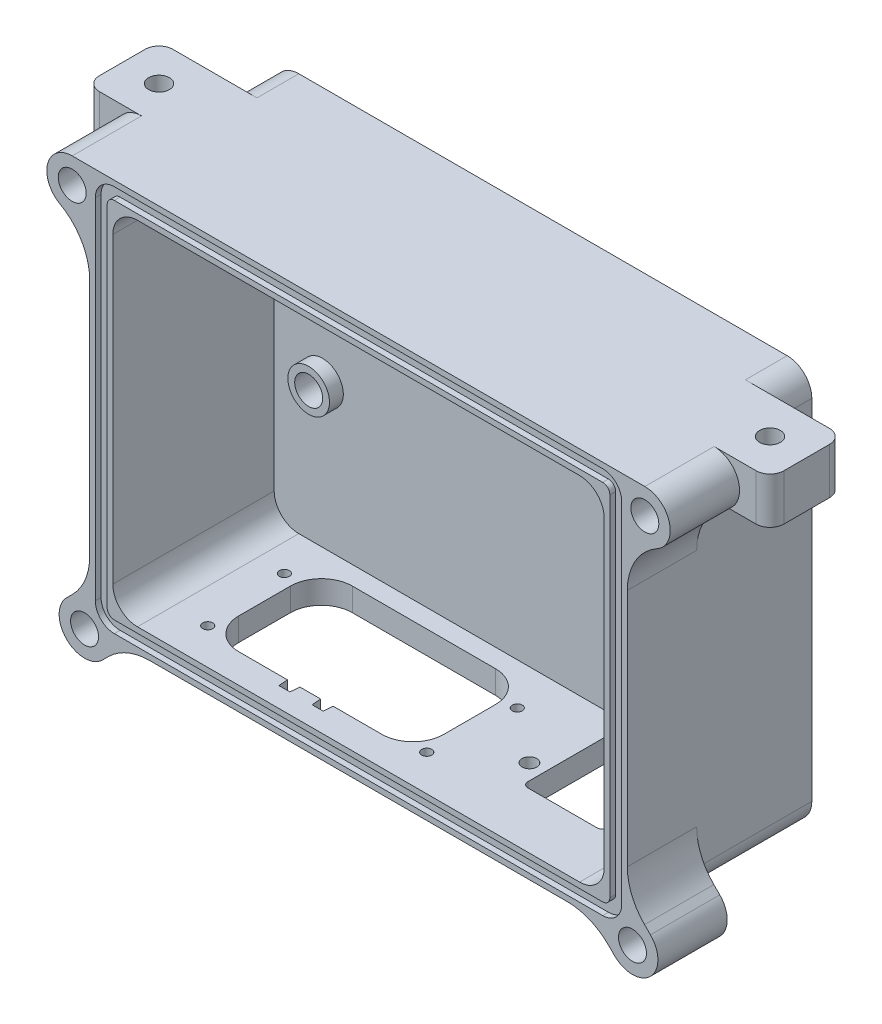
from build123d import *

# Parameters (mm, degrees)
SKETCH1_W             = 106.3625
SKETCH1_H             = 76.2
BOSS_EXTRUDE1_DEPTH   = 34.925
SHELL1_T              = 5
FILLET1_R             = 5.334
CUT_EXTRUDE1_DEPTH    = 1.2446
BOSS_EXTRUDE2_DEPTH   = 15
BOSS_EXTRUDE2_2_DEPTH = 15
SKETCH5_R             = 3.025
CUT_EXTRUDE4_DEPTH    = 8
FILLET2_R             = 12.7
SKETCH6_R             = 4.5
SKETCH6_R_2           = 3.025
BOSS_EXTRUDE3_DEPTH   = 3
CUT_EXTRUDE5_START    = -6
SKETCH7_R             = 3.025
CUT_EXTRUDE5_DEPTH    = 6
BOSS_EXTRUDE4_DEPTH   = 10
BOSS_EXTRUDE5_REACH   = 125.767
SKETCH9_W             = 5.334
SKETCH9_H             = 15.875
FILLET3_R             = 3
BOSS_EXTRUDE6_REACH   = 125.767
SKETCH12_W            = 5.334
SKETCH12_H            = 15.875
M4_CLEARANCE_HOLE1_D  = 4.5
SKETCH13_R            = 1.6
CUT_EXTRUDE6_DEPTH    = 5


with BuildPart() as part:
    # Sketch1 → Boss-Extrude1 (new body)
    with BuildSketch(Plane.XY):
        Rectangle(SKETCH1_W, SKETCH1_H)
    extrude(amount=BOSS_EXTRUDE1_DEPTH)

    # Shell1
    shell1_openings = [part.faces().sort_by_distance(p)[0] for p in [
        (0, 0, 34.925),
    ]]
    offset(amount=SHELL1_T, openings=shell1_openings, kind=Kind.INTERSECTION)

    # Fillet1
    # the kernel refuses this fillet: 5.334 mm, written as the material it adds along each edge
    with BuildSketch(Plane(origin=(53.18125, -38.1, 0), x_dir=(0, 1, 0), z_dir=(0, 0, 1)), Plane(origin=(53.18125, 38.1, 0), x_dir=(-1, 0, 0), z_dir=(0, 0, 1)), Plane(origin=(-53.18125, -38.1, 0), x_dir=(1, 0, 0), z_dir=(0, 0, 1))) as fillet1_piece_1:
        with BuildLine():
            CenterArc((FILLET1_R, FILLET1_R), FILLET1_R, 180, 90)
            Line((0, FILLET1_R), (0, 0))
            Line((0, 0), (FILLET1_R, 0))
        make_face()
    extrude(amount=34.925)
    with BuildSketch(Plane(origin=(-53.18125, 38.1, 0), x_dir=(1, 0, 0), z_dir=(0, 0, 1))) as fillet1_piece_2:
        with BuildLine():
            CenterArc((FILLET1_R, -FILLET1_R), FILLET1_R, 90, 90)
            Line((0, -FILLET1_R), (0, 0))
            Line((0, 0), (FILLET1_R, 0))
        make_face()
    extrude(amount=34.925)
    # the kernel refuses this fillet: 5.334 mm, written as the material it takes off along each edge
    with BuildSketch(Plane(origin=(58.18125, -43.1, 48.26), x_dir=(-1, 0, 0), z_dir=(0, 0, -1)), Plane(origin=(-58.18125, 43.1, -18.335), x_dir=(0, -1, 0), z_dir=(0, 0, 1))) as fillet1_2_piece_1:
        with BuildLine():
            CenterArc((FILLET1_R, FILLET1_R), FILLET1_R, 180, 90)
            Line((0, FILLET1_R), (0, 0))
            Line((0, 0), (FILLET1_R, 0))
        make_face()
    extrude(amount=66.595, mode=Mode.SUBTRACT)
    with BuildSketch(Plane(origin=(-58.18125, -43.1, 48.26), x_dir=(1, 0, 0), z_dir=(0, 0, -1)), Plane(origin=(58.18125, 43.1, 48.26), x_dir=(-1, 0, 0), z_dir=(0, 0, -1))) as fillet1_2_piece_2:
        with BuildLine():
            CenterArc((FILLET1_R, -FILLET1_R), FILLET1_R, 90, 90)
            Line((0, -FILLET1_R), (0, 0))
            Line((0, 0), (FILLET1_R, 0))
        make_face()
    extrude(amount=66.595, mode=Mode.SUBTRACT)

    # Sketch2 → Cut-Extrude1 (cut)
    with BuildSketch(Plane.XY.offset(34.925)):
        with BuildLine():
            Line((-52.84725, -41.8827), (52.84725, -41.8827))
            ThreePointArc((52.84725, -41.8827), (55.758196486, -40.676946486), (56.96395, -37.766))
            Line((56.96395, -37.766), (56.96395, 37.766))
            ThreePointArc((56.96395, 37.766), (55.758196486, 40.676946486), (52.84725, 41.8827))
            Line((52.84725, 41.8827), (-52.84725, 41.8827))
            ThreePointArc((-52.84725, 41.8827), (-55.758196486, 40.676946486), (-56.96395, 37.766))
            Line((-56.96395, 37.766), (-56.96395, -37.766))
            ThreePointArc((-56.96395, -37.766), (-55.758196486, -40.676946486), (-52.84725, -41.8827))
        make_face()
        with BuildLine():
            Line((-54.39855, 37.766), (-54.39855, -37.766))
            ThreePointArc((-54.39855, -37.766), (-53.94418475, -38.86293475), (-52.84725, -39.3173))
            Line((-52.84725, -39.3173), (52.84725, -39.3173))
            ThreePointArc((52.84725, -39.3173), (53.94418475, -38.86293475), (54.39855, -37.766))
            Line((54.39855, -37.766), (54.39855, 37.766))
            ThreePointArc((54.39855, 37.766), (53.94418475, 38.86293475), (52.84725, 39.3173))
            Line((52.84725, 39.3173), (-52.84725, 39.3173))
            ThreePointArc((-52.84725, 39.3173), (-53.94418475, 38.86293475), (-54.39855, 37.766))
        make_face(mode=Mode.SUBTRACT)
    extrude(amount=-CUT_EXTRUDE1_DEPTH, mode=Mode.SUBTRACT)


with BuildPart() as body_2:
    # Sketch4 → Boss-Extrude2 (new body)
    with BuildSketch(Plane.XY.offset(34.925)):
        with BuildLine():
            ThreePointArc((52.84725, 43.1), (56.618957571, 41.537707571), (58.18125, 37.766))
            Line((58.18125, 37.766), (58.18125, 32.1))
            Line((58.18125, 32.1), (61.96395, 32.1))
            ThreePointArc((61.96395, 32.1), (67.46395, 37.6), (61.96395, 43.1))
            Line((61.96395, 43.1), (52.84725, 43.1))
        make_face()
    extrude(amount=-BOSS_EXTRUDE2_DEPTH)


with BuildPart() as body_3:
    # Sketch4 → Boss-Extrude2 2 (new body)
    with BuildSketch(Plane.XY.offset(34.925)):
        with BuildLine():
            Line((63.182817689, -40.323393096), (58.18125, -35.321825407))
            Line((58.18125, -35.321825407), (58.18125, -37.766))
            ThreePointArc((58.18125, -37.766), (57.775223426, -39.807233428), (56.618957571, -41.537707571))
            ThreePointArc((56.618957571, -41.537707571), (54.888483428, -42.693973426), (52.84725, -43.1))
            Line((52.84725, -43.1), (50.403075407, -43.1))
            Line((50.403075407, -43.1), (55.404643096, -48.101567689))
            ThreePointArc((55.404643096, -48.101567689), (63.182817689, -48.101567689), (63.182817689, -40.323393096))
        make_face()
    extrude(amount=-BOSS_EXTRUDE2_2_DEPTH)


with BuildPart() as cut_extrude4_tool:
    # Sketch5 → Cut-Extrude4 (new body)
    with BuildSketch(Plane.XY.offset(34.925)):
        with Locations((59.293730392, -44.212480392)):
            Circle(SKETCH5_R)
        with Locations((61.96395, 37.6)):
            Circle(SKETCH5_R)
    extrude(amount=-CUT_EXTRUDE4_DEPTH)


with BuildPart() as body_2_1:
    add(body_2.part)

    # Cut-Extrude4: cut by cut_extrude4_tool
    add(cut_extrude4_tool.part, mode=Mode.SUBTRACT)


with BuildPart() as body_3_1:
    add(body_3.part)

    # Cut-Extrude4: cut by cut_extrude4_tool
    add(cut_extrude4_tool.part, mode=Mode.SUBTRACT)


with BuildPart() as body_4:
    # Mirror3: mirrored copy
    add(body_3_1.part.mirror(Plane(origin=(0, 0, 0), x_dir=(0, 0, 1), z_dir=(1, 0, 0))))


with BuildPart() as body_5:
    # Mirror3 2: mirrored copy
    add(body_2_1.part.mirror(Plane(origin=(0, 0, 0), x_dir=(0, 0, 1), z_dir=(1, 0, 0))))


with BuildPart() as part_1:
    add(part.part)

    # Combine3: union body 3, body 2, body 4, body 5
    add(body_3_1.part)
    add(body_2_1.part)
    add(body_4.part)
    add(body_5.part)

    # Fillet2
    # the kernel refuses this fillet: 12.7 mm, written as the material it adds along each edge
    with BuildSketch(Plane(origin=(-58.18125, 32.1, 34.925), x_dir=(-0.9941224670877488, 0.10826135243644415, 0), z_dir=(0, 0, -1))) as fillet2_piece_1_section:
        with BuildLine():
            CenterArc((11.503146113, -11.67973592), FILLET2_R, 113.1229538, 60.661946359)
            Line((-1.122209219, -10.304816744), (-2.384744752, -10.167324826))
            Line((-2.384744752, -10.167324826), (-1.262535533, 0.137491918))
            Line((-1.262535533, 0.137491918), (0.137491918, 1.262535533))
            ThreePointArc((0.137491918, 1.262535533), (3.897958974, 0.853015315), (6.017049113, 1.167973592))
            Line((6.017049113, 1.167973592), (6.515785204, 0))
        make_face()
    fillet2_piece_1 = extrude(amount=15, mode=Mode.PRIVATE)
    fillet2_piece_1 = split(fillet2_piece_1, bisect_by=Plane(origin=(-56.96395, 28.160512579, 34.3027), z_dir=(-1, 0, 0)), keep=Keep.TOP, mode=Mode.PRIVATE)
    add(fillet2_piece_1)
    with BuildSketch(Plane(origin=(-50.403075407, -43.1, 34.925), x_dir=(-0.7071067811865475, -0.7071067811865475, 0), z_dir=(0, 0, -1)), Plane(origin=(-58.18125, -35.321825407, 34.925), x_dir=(0, 1, 0), z_dir=(0, 0, -1)), Plane(origin=(58.18125, -35.321825407, 34.925), x_dir=(0.7071067811865468, -0.7071067811865482, 0), z_dir=(0, 0, -1))) as fillet2_piece_2:
        with BuildLine():
            CenterArc((FILLET2_R * 0.414213562373, -FILLET2_R), FILLET2_R, 90, 45)
            Line((-FILLET2_R * 0.292893218813, -FILLET2_R * 0.292893218813), (0, 0))
            Line((0, 0), (FILLET2_R * 0.414213562373, 0))
        make_face()
    extrude(amount=15)
    with BuildSketch(Plane(origin=(50.403075407, -43.1, 34.925), x_dir=(0.7071067811865475, -0.7071067811865475, 0), z_dir=(0, 0, -1))) as fillet2_piece_3:
        with BuildLine():
            CenterArc((FILLET2_R * 0.414213562373, FILLET2_R), FILLET2_R, 225, 45)
            Line((-FILLET2_R * 0.292893218813, FILLET2_R * 0.292893218813), (0, 0))
            Line((0, 0), (FILLET2_R * 0.414213562373, 0))
        make_face()
    extrude(amount=15)
    with BuildSketch(Plane(origin=(58.18125, 32.1, 34.925), x_dir=(0, -1, 0), z_dir=(0, 0, -1))) as fillet2_piece_4_section:
        with BuildLine():
            CenterArc((10.365741732, -12.7), FILLET2_R, 90, 60.661946359)
            Line((-0.705407718, -6.477488462), (-1.812522663, -5.855237308))
            ThreePointArc((-1.812522663, -5.855237308), (-1.27, -3.7827), (-1.27, 0))
            Line((-1.27, 0), (0, 1.27))
            Line((0, 1.27), (10.365741732, 1.27))
            Line((10.365741732, 1.27), (10.365741732, 0))
        make_face()
    fillet2_piece_4 = extrude(amount=15, mode=Mode.PRIVATE)
    fillet2_piece_4 = split(fillet2_piece_4, bisect_by=Plane(origin=(56.96395, 28.160512579, 34.3027), z_dir=(1, 0, 0)), keep=Keep.TOP, mode=Mode.PRIVATE)
    add(fillet2_piece_4)

    # Sketch6 → Boss-Extrude3 (add)
    # profile 1 of 7: a face of its own
    with BuildSketch(Plane.XY):
        with Locations((29.025256116, -8.298796641)):
            Circle(SKETCH6_R)
        with Locations((29.025256116, -8.298796641)):
            Circle(SKETCH6_R_2, mode=Mode.SUBTRACT)
    # profile 2 of 7: a face of its own
    with BuildSketch(Plane.XY):
        with Locations((29.025256116, -8.298796641)):
            Circle(SKETCH6_R_2)
    # profile 3 of 7: a face of its own
    with BuildSketch(Plane.XY):
        with Locations((29.025256449, 19.641203359)):
            Circle(SKETCH6_R)
        with Locations((29.025256449, 19.641203359)):
            Circle(SKETCH6_R_2, mode=Mode.SUBTRACT)
    # profile 4 of 7: a face of its own
    with BuildSketch(Plane.XY):
        with Locations((29.025256449, 19.641203359)):
            Circle(SKETCH6_R_2)
    # profile 5 of 7: a face of its own
    with BuildSketch(Plane.XY):
        with Locations((-42.71074387, -7.174795785)):
            Circle(SKETCH6_R)
        with Locations((-42.71074387, -7.174795785)):
            Circle(SKETCH6_R_2, mode=Mode.SUBTRACT)
    # profile 6 of 7: a face of its own
    with BuildSketch(Plane.XY):
        with Locations((-42.71074387, -7.174795785)):
            Circle(SKETCH6_R_2)
    # profile 7 of 7: a face of its own
    with BuildSketch(Plane.XY):
        with Locations((-42.710743561, 18.733204215)):
            Circle(SKETCH6_R)
        with Locations((-42.710743561, 18.733204215)):
            Circle(SKETCH6_R_2, mode=Mode.SUBTRACT)
    extrude(amount=BOSS_EXTRUDE3_DEPTH)

    # Sketch7 → Cut-Extrude5 (cut)
    with BuildSketch(Plane.XY.offset(3).offset(CUT_EXTRUDE5_START)):
        with Locations((-42.710743561, 18.733204215)):
            Circle(SKETCH7_R)
        with Locations((-42.71074387, -7.174795785)):
            Circle(SKETCH7_R)
        with Locations((29.025256449, 19.641203359)):
            Circle(SKETCH7_R)
        with Locations((29.025256116, -8.298796641)):
            Circle(SKETCH7_R)
    extrude(amount=CUT_EXTRUDE5_DEPTH, mode=Mode.SUBTRACT)

    # Sketch8 → Boss-Extrude4 (add)
    with BuildSketch(Plane(origin=(0, 43.1, 0), x_dir=(1, 0, 0), z_dir=(0, 1, 0))):
        with BuildLine():
            Line((-58.18125, -19.925), (-58.18125, -4.05))
            Line((-58.18125, -4.05), (-64.704536438, -10.573286438))
            ThreePointArc((-64.704536438, -10.573286438), (-64.270990935, -11.222133135), (-64.11875, -11.9875))
            ThreePointArc((-64.11875, -11.9875), (-65.353383135, -13.835259065), (-67.532963562, -13.401713562))
            Line((-67.532963562, -13.401713562), (-74.05625, -19.925))
            Line((-74.05625, -19.925), (-58.18125, -19.925))
        make_face()
        with BuildLine():
            Line((-64.704536438, -10.573286438), (-58.18125, -4.05))
            Line((-58.18125, -4.05), (-74.05625, -4.05))
            Line((-74.05625, -4.05), (-74.05625, -19.925))
            Line((-74.05625, -19.925), (-67.532963562, -13.401713562))
            ThreePointArc((-67.532963562, -13.401713562), (-67.532963562, -10.573286438), (-64.704536438, -10.573286438))
        make_face()
        with BuildLine():
            ThreePointArc((-64.11875, -11.9875), (-64.270990935, -11.222133135), (-64.704536438, -10.573286438))
            Line((-64.704536438, -10.573286438), (-67.532963562, -13.401713562))
            ThreePointArc((-67.532963562, -13.401713562), (-65.353383135, -13.835259065), (-64.11875, -11.9875))
        make_face()
        with BuildLine():
            Line((-67.532963562, -13.401713562), (-64.704536438, -10.573286438))
            ThreePointArc((-64.704536438, -10.573286438), (-67.532963562, -10.573286438), (-67.532963562, -13.401713562))
        make_face()
        with BuildLine():
            Line((74.05625, -4.05), (58.18125, -4.05))
            Line((58.18125, -4.05), (58.18125, -19.925))
            Line((58.18125, -19.925), (64.704536438, -13.401713562))
            ThreePointArc((64.704536438, -13.401713562), (64.704536438, -10.573286438), (67.532963562, -10.573286438))
            Line((67.532963562, -10.573286438), (74.05625, -4.05))
        make_face()
        with BuildLine():
            ThreePointArc((67.532963562, -10.573286438), (64.704536438, -10.573286438), (64.704536438, -13.401713562))
            Line((64.704536438, -13.401713562), (67.532963562, -10.573286438))
        make_face()
        with BuildLine():
            Line((67.532963562, -10.573286438), (64.704536438, -13.401713562))
            ThreePointArc((64.704536438, -13.401713562), (66.884116865, -13.835259065), (68.11875, -11.9875))
            ThreePointArc((68.11875, -11.9875), (67.966509065, -11.222133135), (67.532963562, -10.573286438))
        make_face()
        with BuildLine():
            Line((64.704536438, -13.401713562), (58.18125, -19.925))
            Line((58.18125, -19.925), (61.96395, -19.925))
            Line((61.96395, -19.925), (74.05625, -19.925))
            Line((74.05625, -19.925), (74.05625, -4.05))
            Line((74.05625, -4.05), (67.532963562, -10.573286438))
            ThreePointArc((67.532963562, -10.573286438), (67.966509065, -11.222133135), (68.11875, -11.9875))
            ThreePointArc((68.11875, -11.9875), (66.884116865, -13.835259065), (64.704536438, -13.401713562))
        make_face()
    extrude(amount=-BOSS_EXTRUDE4_DEPTH)

    # Sketch9 → Boss-Extrude5 (add, up to next)
    with BuildSketch(Plane(origin=(0, 43.1, 0), x_dir=(1, 0, 0), z_dir=(0, 1, 0)), mode=Mode.PRIVATE) as boss_extrude5_sk1:
        with Locations((-55.51425, -11.9875)):
            Rectangle(SKETCH9_W, SKETCH9_H)
    boss_extrude5_tool1 = extrude(boss_extrude5_sk1.sketch, amount=-BOSS_EXTRUDE5_REACH, mode=Mode.PRIVATE) - part_1.part
    add(boss_extrude5_tool1.solids().sort_by_distance((-55.51425, 43.1, 11.9875))[0])

    # Fillet3
    fillet3_edges = [part_1.edges().sort_by_distance(p)[0] for p in [
        (-74.05625, 38.1, 19.925),
        (-74.05625, 38.1, 4.05),
        (74.05625, 38.1, 4.05),
        (74.05625, 38.1, 19.925),
    ]]
    fillet(fillet3_edges, radius=FILLET3_R)

    # Sketch12 → Boss-Extrude6 (add, up to next)
    with BuildSketch(Plane(origin=(0, 43.1, 0), x_dir=(1, 0, 0), z_dir=(0, 1, 0)), mode=Mode.PRIVATE) as boss_extrude6_sk1:
        with Locations((55.51425, -11.9875)):
            Rectangle(SKETCH12_W, SKETCH12_H)
    boss_extrude6_tool1 = extrude(boss_extrude6_sk1.sketch, amount=-BOSS_EXTRUDE6_REACH, mode=Mode.PRIVATE) - part_1.part
    add(boss_extrude6_tool1.solids().sort_by_distance((55.51425, 43.1, 11.9875))[0])

    # M4 Clearance Hole1 (through all)
    with Locations(Plane(origin=(0, 33.1, 0), x_dir=(-1, 0, 0), z_dir=(0, -1, 0))):
        with Locations((66.11875, -11.9875), (-66.11875, -11.9875)):
            Hole(M4_CLEARANCE_HOLE1_D / 2)

    # Sketch13 → Cut-Extrude6 (cut)
    with BuildSketch(Plane.XZ.offset(43.1)):
        with BuildLine():
            Line((5.469338815, 21.930218955), (5.469338815, 10.730218955))
            ThreePointArc((5.469338815, 10.730218955), (3.506954249, 5.992603521), (-1.230661185, 4.030218955))
            Line((-1.230661185, 4.030218955), (-32.230661185, 4.030218955))
            ThreePointArc((-32.230661185, 4.030218955), (-36.968276619, 5.992603521), (-38.930661185, 10.730218955))
            Line((-38.930661185, 10.730218955), (-38.930661185, 21.930218955))
            ThreePointArc((-38.930661185, 21.930218955), (-36.968276619, 26.667834389), (-32.230661185, 28.630218955))
            Line((-32.230661185, 28.630218955), (-21.688826772, 28.630218955))
            Line((-21.688826772, 28.630218955), (-21.513849445, 30.630218955))
            Line((-21.513849445, 30.630218955), (-19.147472925, 30.630218955))
            Line((-19.147472925, 30.630218955), (-18.972495598, 28.630218955))
            Line((-18.972495598, 28.630218955), (-14.488826772, 28.630218955))
            Line((-14.488826772, 28.630218955), (-14.313849445, 30.630218955))
            Line((-14.313849445, 30.630218955), (-11.947472925, 30.630218955))
            Line((-11.947472925, 30.630218955), (-11.772495598, 28.630218955))
            Line((-11.772495598, 28.630218955), (-1.230661185, 28.630218955))
            ThreePointArc((-1.230661185, 28.630218955), (3.506954249, 26.667834389), (5.469338815, 21.930218955))
        make_face()
        with BuildLine():
            Line((40.68125, 21.725), (40.68125, 5.275))
            ThreePointArc((40.68125, 5.275), (40.344422798, 4.461827202), (39.53125, 4.125))
            Line((39.53125, 4.125), (24.58125, 4.125))
            ThreePointArc((24.58125, 4.125), (23.768077202, 4.461827202), (23.43125, 5.275))
            Line((23.43125, 5.275), (23.43125, 21.725))
            ThreePointArc((23.43125, 21.725), (23.768077202, 22.538172798), (24.58125, 22.875))
            Line((24.58125, 22.875), (39.53125, 22.875))
            ThreePointArc((39.53125, 22.875), (40.344422798, 22.538172798), (40.68125, 21.725))
        make_face()
        with BuildLine():
            ThreePointArc((-39.345661185, 27.130218955), (-40.430661185, 28.215218955), (-41.515661185, 27.130218955))
            ThreePointArc((-41.515661185, 27.130218955), (-40.430661185, 26.045218955), (-39.345661185, 27.130218955))
        make_face()
        with BuildLine():
            ThreePointArc((-40.845661185, 9.030218955), (-41.930661185, 10.115218955), (-43.015661185, 9.030218955))
            ThreePointArc((-43.015661185, 9.030218955), (-41.930661185, 7.945218955), (-40.845661185, 9.030218955))
        make_face()
        with BuildLine():
            ThreePointArc((9.554338815, 9.030218955), (8.469338815, 10.115218955), (7.384338815, 9.030218955))
            ThreePointArc((7.384338815, 9.030218955), (8.469338815, 7.945218955), (9.554338815, 9.030218955))
        make_face()
        with BuildLine():
            ThreePointArc((8.054338815, 27.130218955), (6.969338815, 28.215218955), (5.884338815, 27.130218955))
            ThreePointArc((5.884338815, 27.130218955), (6.969338815, 26.045218955), (8.054338815, 27.130218955))
        make_face()
        with Locations(Location((20.05625, 18, 0), (0, 0, 270))):
            Circle(SKETCH13_R)
        with Locations(Location((44.05625, 9, 0), (0, 0, 270))):
            Circle(SKETCH13_R)
    extrude(amount=-CUT_EXTRUDE6_DEPTH, mode=Mode.SUBTRACT)


solid = part_1.part
